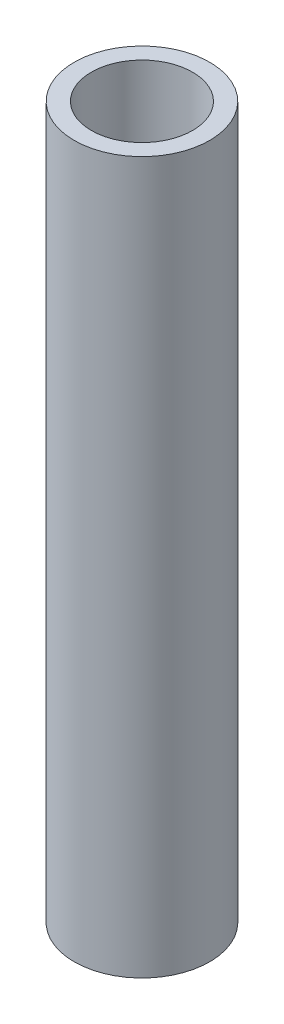
from build123d import *

# Parameters (mm, degrees)
SKETCH1_R           = 9.525
SKETCH1_R_2         = 7.112
BOSS_EXTRUDE1_DEPTH = 100


with BuildPart() as part:
    # Sketch1 → Boss-Extrude1 (new body)
    with BuildSketch(Plane(origin=(0, 0, 0), x_dir=(1, 0, 0), z_dir=(0, 1, 0))):
        Circle(SKETCH1_R)
        Circle(SKETCH1_R_2, mode=Mode.SUBTRACT)
    extrude(amount=BOSS_EXTRUDE1_DEPTH)


solid = part.part
